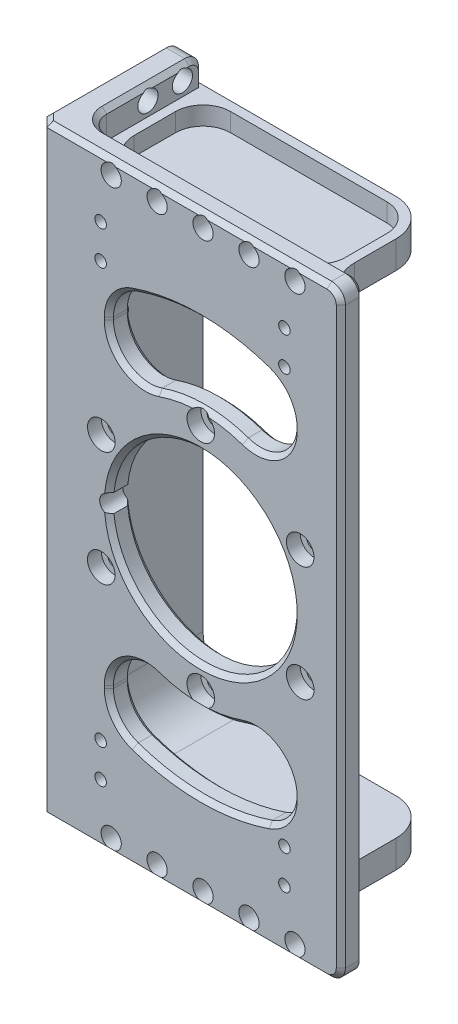
from build123d import *

# Parameters (mm, degrees)
SKETCH_1_W                  = 60
SKETCH_1_H                  = 131
EXTRUDE_1_DEPTH             = 5
SKETCH_2_W                  = 30
SKETCH_2_H                  = 131
EXTRUDE_2_DEPTH             = 6
SKETCH_3_R                  = 20
CUT_EXTRUDE_1_DEPTH         = 10
CHAMFER_1_SIZE              = 2
FILLET_1_R                  = 3
SKETCH_13_R                 = 1.6
CUT_EXTRUDE_2_DEPTH         = 6
SKETCH_14_R                 = 3
CUT_EXTRUDE_3_DEPTH         = 3
CHAMFER_4_SIZE              = 1
SKETCH_16_W                 = 50
SKETCH_16_H                 = 6
EXTRUDE_4_DEPTH             = 25
FILLET_3_R                  = 4
FILLET_4_R                  = 10
FILLET_5_R                  = 8
CUT_EXTRUDE_4_DEPTH         = 4
FILLET_6_R                  = 6
SKETCH_19_R                 = 2.2
CUT_EXTRUDE_5_DEPTH         = 18
SKETCH_20_R                 = 2.2
CUT_EXTRUDE_6_DEPTH         = 18
HOLE_WIZARD_M3_1_AT_2_COUNT = 2
HOLE_WIZARD_M3_1_AT_2_PITCH = 40
HOLE_WIZARD_M3_1_AT_3_COUNT = 2
HOLE_WIZARD_M3_1_AT_3_PITCH = 105.617529322
HOLE_WIZARD_M3_1_AT_4_COUNT = 2
HOLE_WIZARD_M3_1_AT_4_PITCH = 97.75
HOLE_WIZARD_M4_1_D          = 3.3
HOLE_WIZARD_M4_1_DEPTH      = 10.1
HOLE_WIZARD_M4_1_TIP        = 0.991420021
CUT_EXTRUDE_7_DEPTH         = 10
FILLET_7_R                  = 8
CHAMFER_5_SIZE              = 1
CHAMFER_6_SIZE              = 1
SKETCH_29_R                 = 2
CUT_EXTRUDE_8_DEPTH         = 10
SKETCH_30_R                 = 1.5
CUT_EXTRUDE_9_DEPTH         = 3
PATTERN_CIRCULAR_1_COUNT    = 6


# Some blends are built 0.0001 mm under size
with BuildPart() as part:
    # 草图1 → 凸台-拉伸1 (new body)
    with BuildSketch(Plane.XY):
        with Locations((-207.175860782, 60.5)):
            Rectangle(SKETCH_1_W, SKETCH_1_H)
    extrude(amount=EXTRUDE_1_DEPTH)

    # 草图2 → 凸台-拉伸2 (add)
    with BuildSketch(Plane.ZY.offset(237.175860782)):
        with Locations((-10, 60.5)):
            Rectangle(SKETCH_2_W, SKETCH_2_H)
    extrude(amount=EXTRUDE_2_DEPTH)

    # 草图3 → 切除-拉伸1 (cut)
    with BuildSketch(Plane.XY.offset(5)):
        with Locations((-207.675860782, 60.5)):
            Circle(SKETCH_3_R)
    extrude(amount=-CUT_EXTRUDE_1_DEPTH, mode=Mode.SUBTRACT)

    # 倒角1
    chamfer_1_edges = [part.edges().sort_by_distance(p)[0] for p in [
        (-243.175860782, 60.5, 5),
    ]]
    chamfer(chamfer_1_edges, length=CHAMFER_1_SIZE)

    # 圆角1
    fillet_1_edges = [part.edges().sort_by_distance(p)[0] for p in [
        (-240.175860782, 126, -25),
        (-240.175860782, -5, -25),
        (-177.175860782, 126, 2.5),
        (-177.175860782, -5, 2.5),
    ]]
    fillet(fillet_1_edges, radius=FILLET_1_R)

    # 草图13 → 切除-拉伸2 (cut)
    with BuildSketch(Plane.XY.offset(5)):
        with Locations((-207.675860782, 85.5)):
            Circle(SKETCH_13_R)
        with Locations((-229.326495877, 73)):
            Circle(SKETCH_13_R)
        with Locations((-186.025225688, 73)):
            Circle(SKETCH_13_R)
        with Locations((-186.025225688, 48)):
            Circle(SKETCH_13_R)
        with Locations((-207.675860782, 35.5)):
            Circle(SKETCH_13_R)
        with Locations((-229.326495877, 48)):
            Circle(SKETCH_13_R)
    extrude(amount=-CUT_EXTRUDE_2_DEPTH, mode=Mode.SUBTRACT)

    # 草图14 → 切除-拉伸3 (cut)
    with BuildSketch(Plane.XY.offset(5)):
        with Locations((-207.675860782, 85.5)):
            Circle(SKETCH_14_R)
        with Locations((-186.025225688, 73)):
            Circle(SKETCH_14_R)
        with Locations((-186.025225688, 48)):
            Circle(SKETCH_14_R)
        with Locations((-207.675860782, 35.5)):
            Circle(SKETCH_14_R)
        with Locations((-229.326495877, 48)):
            Circle(SKETCH_14_R)
        with Locations((-229.326495877, 73)):
            Circle(SKETCH_14_R)
    extrude(amount=-CUT_EXTRUDE_3_DEPTH, mode=Mode.SUBTRACT)

    # 倒角4
    chamfer_4_edges = [part.edges().sort_by_distance(p)[0] for p in [
        (-243.175860782, 126, -9.5),
        (-242.175860782, 126, 4),
        (-210.675860782, -5, 5),
        (-242.175860782, -5, 4),
        (-243.175860782, 60.5, -25),
        (-210.675860782, 126, 5),
        (-243.175860782, -5, -9.5),
        (-243.175860782, -4.121320344, -24.121320344),
        (-243.175860782, 125.121320344, -24.121320344),
        (-177.175860782, 60.5, 5),
        (-178.054540439, -4.121320344, 5),
        (-178.054540439, 125.121320344, 5),
    ]]
    chamfer(chamfer_4_edges, length=CHAMFER_4_SIZE)

    # 草图16 → 凸台-拉伸4 (add)
    with BuildSketch(Plane(origin=(0, 0, 0), x_dir=(-1, 0, 0), z_dir=(0, 0, -1))):
        with Locations((212.175860782, 117)):
            Rectangle(SKETCH_16_W, SKETCH_16_H)
    extrude_4 = extrude(amount=EXTRUDE_4_DEPTH)

    # 镜向1: 凸台-拉伸4 across plane
    add(extrude_4.mirror(Plane(origin=(0, 60.5, 0), x_dir=(0, 0, 1), z_dir=(0, -1, 0))))

    # 圆角3
    fillet_3_edges = [part.edges().sort_by_distance(p)[0] for p in [
        (-237.175860782, -2, 0),
        (-237.175860782, 123, 0),
    ]]
    fillet(fillet_3_edges, radius=FILLET_3_R)

    # 圆角4
    fillet_4_edges = [part.edges().sort_by_distance(p)[0] for p in [
        (-237.175860782, 114, -12.5),
        (-237.175860782, 7, -12.5),
    ]]
    fillet(fillet_4_edges, radius=FILLET_4_R)

    # 圆角5
    fillet_5_edges = [part.edges().sort_by_distance(p)[0] for p in [
        (-187.175860782, 117, -25),
        (-187.175860782, 117, 0),
        (-187.175860782, 4, 0),
        (-187.175860782, 4, -25),
    ]]
    fillet(fillet_5_edges, radius=FILLET_5_R)

    # 草图17 → 切除-拉伸4 (cut)
    with BuildSketch(Plane(origin=(0, 120, 0), x_dir=(1, 0, 0), z_dir=(0, 1, 0))):
        with BuildLine():
            Line((-235.175860782, 4), (-235.175860782, 2))
            Line((-235.175860782, 2), (-233.175860782, 2))
            Line((-233.175860782, 2), (-187.175860782, 2))
            ThreePointArc((-187.175860782, 2), (-188.662693763, 4.83772234), (-189.175860782, 8))
            Line((-189.175860782, 8), (-189.175860782, 17))
            ThreePointArc((-189.175860782, 17), (-190.933220095, 21.242640687), (-195.175860782, 23))
            Line((-195.175860782, 23), (-235.175860782, 23))
            Line((-235.175860782, 23), (-235.175860782, 4))
        make_face()
    cut_extrude_4 = extrude(amount=-CUT_EXTRUDE_4_DEPTH, mode=Mode.SUBTRACT)

    # 镜向2: 切除-拉伸4 across plane
    add(cut_extrude_4.mirror(Plane(origin=(0, 60.5, 0), x_dir=(0, 0, 1), z_dir=(0, -1, 0))), mode=Mode.SUBTRACT)

    # 圆角6
    fillet_6_edges = [part.edges().sort_by_distance(p)[0] for p in [
        (-187.175860782, 118, -2),
        (-235.175860782, 118, -23),
        (-235.175860782, 118, -2),
        (-235.175860782, 3, -23),
        (-187.175860782, 3, -2),
        (-235.175860782, 3, -2),
    ]]
    fillet(fillet_6_edges, radius=FILLET_6_R - 0.0001)  # a hair under: the kernel refuses the full size

    # 草图19 → 切除-拉伸5 (cut)
    with BuildSketch(Plane.XY.offset(5)):
        with Locations((-217.175860782, -2)):
            Circle(SKETCH_19_R)
        with Locations((-187.175860782, -2)):
            Circle(SKETCH_19_R)
        with Locations((-197.175860782, -2)):
            Circle(SKETCH_19_R)
        with Locations((-207.175860782, -2)):
            Circle(SKETCH_19_R)
        with Locations((-227.175860782, -2)):
            Circle(SKETCH_19_R)
    cut_extrude_5 = extrude(amount=-CUT_EXTRUDE_5_DEPTH, mode=Mode.SUBTRACT)

    # 镜向3: 切除-拉伸5 across plane
    add(cut_extrude_5.mirror(Plane(origin=(0, 60.5, 0), x_dir=(0, 0, 1), z_dir=(0, -1, 0))), mode=Mode.SUBTRACT)

    # 草图20 → 切除-拉伸6 (cut)
    with BuildSketch(Plane.ZY.offset(243.175860782)):
        with Locations((-20.5, -2)):
            Circle(SKETCH_20_R)
        with Locations((-13, -2)):
            Circle(SKETCH_20_R)
    cut_extrude_6 = extrude(amount=-CUT_EXTRUDE_6_DEPTH, mode=Mode.SUBTRACT)

    # 镜向4: 切除-拉伸6 across plane
    add(cut_extrude_6.mirror(Plane(origin=(0, 60.5, 0), x_dir=(0, 0, 1), z_dir=(0, -1, 0))), mode=Mode.SUBTRACT)

    # 草图23 → M3 螺纹孔1 (revolve, cut)
    with BuildSketch(Plane(origin=(-229.465860782, 113.065, 5), x_dir=(0, -1, 0), z_dir=(1, 0, 0))):
        Polygon((0, 0), (0, 8.251075774), (1.25, 7.5), (1.25, 0), align=None)
    hole_wizard_m3_1 = revolve(axis=Axis((-229.465860782, 113.065, 11.35), (0, 0, -1)), mode=Mode.SUBTRACT)

    # M3 螺纹孔1 at 2: M3 螺纹孔1 ×2
    with Locations(*[(i * HOLE_WIZARD_M3_1_AT_2_PITCH, 0, 0) for i in range(1, HOLE_WIZARD_M3_1_AT_2_COUNT)]):
        add(hole_wizard_m3_1, mode=Mode.SUBTRACT)

    # M3 螺纹孔1 at 3: M3 螺纹孔1 ×2
    with Locations(*[Vector(0.3787250114344214, -0.9255092466928666, 0) * (i * HOLE_WIZARD_M3_1_AT_3_PITCH) for i in range(1, HOLE_WIZARD_M3_1_AT_3_COUNT)]):
        add(hole_wizard_m3_1, mode=Mode.SUBTRACT)

    # M3 螺纹孔1 at 4: M3 螺纹孔1 ×2
    with Locations(*[(0, -i * HOLE_WIZARD_M3_1_AT_4_PITCH, 0) for i in range(1, HOLE_WIZARD_M3_1_AT_4_COUNT)]):
        add(hole_wizard_m3_1, mode=Mode.SUBTRACT)

    # 镜向5: M3 螺纹孔1 across plane
    add(hole_wizard_m3_1.mirror(Plane(origin=(0, 60.5, 0), x_dir=(0, 0, 1), z_dir=(0, -1, 0))), mode=Mode.SUBTRACT)

    # 镜向5 copy 1 sketch → 镜向5 copy 1 (revolve, cut)
    with BuildSketch(Plane(origin=(-189.465860782, 7.935, 5), x_dir=(0, 1, 0), z_dir=(1, 0, 0))):
        Polygon((0, 0), (0, -8.251075774), (1.25, -7.5), (1.25, 0), align=None)
    revolve(axis=Axis((-189.465860782, 7.935, 11.35), (0, 0, 1)), mode=Mode.SUBTRACT)

    # 镜向5 copy 2 sketch → 镜向5 copy 2 (revolve, cut)
    with BuildSketch(Plane(origin=(-189.465860782, 105.685, 5), x_dir=(0, 1, 0), z_dir=(1, 0, 0))):
        Polygon((0, 0), (0, -8.251075774), (1.25, -7.5), (1.25, 0), align=None)
    revolve(axis=Axis((-189.465860782, 105.685, 11.35), (0, 0, 1)), mode=Mode.SUBTRACT)

    # 镜向5 copy 3 sketch → 镜向5 copy 3 (revolve, cut)
    with BuildSketch(Plane(origin=(-229.465860782, 105.685, 5), x_dir=(0, 1, 0), z_dir=(1, 0, 0))):
        Polygon((0, 0), (0, -8.251075774), (1.25, -7.5), (1.25, 0), align=None)
    revolve(axis=Axis((-229.465860782, 105.685, 11.35), (0, 0, 1)), mode=Mode.SUBTRACT)

    # M4 螺纹孔1
    with Locations(Plane.ZY.offset(243.175860782)):
        with Locations((-7.12, 85.8), (-7.12, 35.2)):
            Hole(HOLE_WIZARD_M4_1_D / 2, depth=HOLE_WIZARD_M4_1_DEPTH)
            with Locations((0, 0, -(HOLE_WIZARD_M4_1_DEPTH + HOLE_WIZARD_M4_1_TIP / 2))):  # 118° drill point
                Cone(0, HOLE_WIZARD_M4_1_D / 2, HOLE_WIZARD_M4_1_TIP, mode=Mode.SUBTRACT)

    # 草图27 → 切除-拉伸7 (cut)
    with BuildSketch(Plane(origin=(0, 0, 0), x_dir=(-1, 0, 0), z_dir=(0, 0, -1))):
        with BuildLine():
            Line((187.675860782, 100.811288741), (187.675860782, 80.803940504))
            ThreePointArc((187.675860782, 80.803940504), (207.675860782, 89), (227.675860782, 80.803940504))
            Line((227.675860782, 80.803940504), (227.675860782, 100.811288741))
            ThreePointArc((227.675860782, 100.811288741), (207.675860782, 105.5), (187.675860782, 100.811288741))
        make_face()
        with BuildLine():
            Line((187.675860782, 40.196059496), (187.675860782, 20.188711259))
            ThreePointArc((187.675860782, 20.188711259), (207.675860782, 15.5), (227.675860782, 20.188711259))
            Line((227.675860782, 20.188711259), (227.675860782, 40.196059496))
            ThreePointArc((227.675860782, 40.196059496), (207.675860782, 32), (187.675860782, 40.196059496))
        make_face()
    extrude(amount=-CUT_EXTRUDE_7_DEPTH, mode=Mode.SUBTRACT)

    # 圆角7
    fillet_7_edges = [part.edges().sort_by_distance(p)[0] for p in [
        (-227.675860782, 80.803940504, 2.5),
        (-187.675860782, 80.803940504, 2.5),
        (-187.675860782, 100.811288741, 2.5),
        (-227.675860782, 100.811288741, 2.5),
        (-227.675860782, 20.188711259, 2.5),
        (-187.675860782, 20.188711259, 2.5),
        (-187.675860782, 40.196059496, 2.5),
        (-227.675860782, 40.196059496, 2.5),
    ]]
    fillet(fillet_7_edges, radius=FILLET_7_R)

    # 倒角5
    # the kernel refuses this chamfer: 1 mm, written as the material it takes off along each edge
    with BuildSketch(Plane(origin=(-207.675860782, 60.5, 0), x_dir=(1, 0, 0), z_dir=(0, -1, 0))) as chamfer_5_piece_1:
        Polygon((20 + CHAMFER_5_SIZE, 0), (20, CHAMFER_5_SIZE), (20, 0), align=None)
    revolve(axis=Axis((-207.675860782, 60.5, 0), (0, 0, 1)), mode=Mode.SUBTRACT)
    with BuildSketch(Plane(origin=(-207.675860782, 60.5, 5), x_dir=(1, 0, 0), z_dir=(0, -1, 0))) as chamfer_5_piece_2:
        Polygon((20, -CHAMFER_5_SIZE), (20 + CHAMFER_5_SIZE, 0), (20, 0), align=None)
    revolve(axis=Axis((-207.675860782, 60.5, 5), (0, 0, 1)), mode=Mode.SUBTRACT)
    with BuildSketch(Plane(origin=(-207.675860782, 60.5, 5), x_dir=(0.3243243243243247, -0.9459459459459458, 0), z_dir=(0.9459459459459458, 0.3243243243243247, 0))) as chamfer_5_piece_3:
        Polygon((45, CHAMFER_5_SIZE), (45 + CHAMFER_5_SIZE, 0), (45, 0), align=None)
    revolve(axis=Axis((-207.675860782, 60.5, 5), (0, 0, -1)), revolution_arc=37.849288832, mode=Mode.SUBTRACT)
    with BuildSketch(Plane(origin=(-207.675860782, 60.5, 0), x_dir=(0.3243243243243247, -0.9459459459459458, 0), z_dir=(0.9459459459459458, 0.3243243243243247, 0))) as chamfer_5_piece_4:
        Polygon((45 + CHAMFER_5_SIZE, 0), (45, -CHAMFER_5_SIZE), (45, 0), align=None)
    revolve(axis=Axis((-207.675860782, 60.5, 0), (0, 0, -1)), revolution_arc=37.849288832, mode=Mode.SUBTRACT)
    with BuildSketch(Plane(origin=(-187.675860782, 26.028997694, 5), x_dir=(-0.02749587661058217, 0, -0.9996219169112968), z_dir=(0, -1, 0)), Plane(origin=(-187.675860782, 26.028997694, 0), x_dir=(0.9996219169112968, 0, -0.027495876610586483), z_dir=(0, -1, 0)), Plane(origin=(-227.675860782, 25.5, 5), x_dir=(0.02749587661058217, 0, -0.9996219169112968), z_dir=(0, 1, 0)), Plane(origin=(-227.675860782, 25.5, 0), x_dir=(-0.9996219169112968, 0, -0.027495876610586483), z_dir=(0, 1, 0)), Plane(origin=(-187.675860782, 95.5, 5), x_dir=(-0.02749587661058217, 0, -0.9996219169112968), z_dir=(0, -1, 0)), Plane(origin=(-187.675860782, 95.5, 0), x_dir=(0.9996219169112968, 0, -0.027495876610586483), z_dir=(0, -1, 0)), Plane(origin=(-227.675860782, 94.971002306, 5), x_dir=(0.02749587661058217, 0, -0.9996219169112968), z_dir=(0, 1, 0)), Plane(origin=(-227.675860782, 94.971002306, 0), x_dir=(-0.9996219169112968, 0, -0.027495876610586483), z_dir=(0, 1, 0))) as chamfer_5_piece_5:
        Polygon((CHAMFER_5_SIZE * 0.999621916911, CHAMFER_5_SIZE * 0.0274958766106), (-CHAMFER_5_SIZE * 0.0274958766106, CHAMFER_5_SIZE * 0.999621916911), (0, 0), align=None)
    extrude(amount=0.528997694, mode=Mode.SUBTRACT)
    with BuildSketch(Plane(origin=(-207.675860782, 60.5, 5), x_dir=(0.3287671232876714, -0.9444110220900375, 0), z_dir=(0.9444110220900375, 0.3287671232876714, 0))) as chamfer_5_piece_6:
        Polygon((28.5, CHAMFER_5_SIZE), (28.5 - CHAMFER_5_SIZE, 0), (28.5, 0), align=None)
    revolve(axis=Axis((-207.675860782, 60.5, 5), (0, 0, -1)), revolution_arc=38.387923948, mode=Mode.SUBTRACT)
    with BuildSketch(Plane(origin=(-207.675860782, 60.5, 0), x_dir=(-0.3287671232876714, -0.9444110220900375, 0), z_dir=(-0.9444110220900375, 0.3287671232876714, 0))) as chamfer_5_piece_7:
        Polygon((28.5 - CHAMFER_5_SIZE, 0), (28.5, CHAMFER_5_SIZE), (28.5, 0), align=None)
    revolve(axis=Axis((-207.675860782, 60.5, 0), (0, 0, 1)), revolution_arc=38.387923948, mode=Mode.SUBTRACT)
    with BuildSketch(Plane(origin=(-207.675860782, 60.5, 5), x_dir=(-0.3287671232876707, 0.9444110220900377, 0), z_dir=(-0.9444110220900377, -0.3287671232876707, 0))) as chamfer_5_piece_8:
        Polygon((28.5, CHAMFER_5_SIZE), (28.5 - CHAMFER_5_SIZE, 0), (28.5, 0), align=None)
    revolve(axis=Axis((-207.675860782, 60.5, 5), (0, 0, -1)), revolution_arc=38.387923948, mode=Mode.SUBTRACT)
    with BuildSketch(Plane(origin=(-207.675860782, 60.5, 0), x_dir=(0.3287671232876697, 0.944411022090038, 0), z_dir=(0.944411022090038, -0.3287671232876697, 0))) as chamfer_5_piece_9:
        Polygon((28.5 - CHAMFER_5_SIZE, 0), (28.5, CHAMFER_5_SIZE), (28.5, 0), align=None)
    revolve(axis=Axis((-207.675860782, 60.5, 0), (0, 0, 1)), revolution_arc=38.387923948, mode=Mode.SUBTRACT)
    with BuildSketch(Plane(origin=(-207.675860782, 60.5, 5), x_dir=(-0.32432432432432445, 0.9459459459459459, 0), z_dir=(-0.9459459459459459, -0.32432432432432445, 0))) as chamfer_5_piece_10:
        Polygon((45, CHAMFER_5_SIZE), (45 + CHAMFER_5_SIZE, 0), (45, 0), align=None)
    revolve(axis=Axis((-207.675860782, 60.5, 5), (0, 0, -1)), revolution_arc=37.849288832, mode=Mode.SUBTRACT)
    with BuildSketch(Plane(origin=(-207.675860782, 60.5, 0), x_dir=(-0.32432432432432434, 0.9459459459459459, 0), z_dir=(-0.9459459459459459, -0.32432432432432434, 0))) as chamfer_5_piece_11:
        Polygon((45 + CHAMFER_5_SIZE, 0), (45, -CHAMFER_5_SIZE), (45, 0), align=None)
    revolve(axis=Axis((-207.675860782, 60.5, 0), (0, 0, -1)), revolution_arc=37.849288832, mode=Mode.SUBTRACT)
    with BuildSketch(Plane(origin=(-195.675860782, 25.5, 0), x_dir=(1, 0, 0), z_dir=(0, 1, 0))) as chamfer_5_piece_12:
        Polygon((8 + CHAMFER_5_SIZE, 0), (8, -CHAMFER_5_SIZE), (8, 0), align=None)
    revolve(axis=Axis((-195.675860782, 25.5, 0), (0, 0, -1)), revolution_arc=71.075355584, mode=Mode.SUBTRACT)
    with BuildSketch(Plane(origin=(-195.675860782, 25.5, 5), x_dir=(1, 0, 0), z_dir=(0, 1, 0))) as chamfer_5_piece_13:
        Polygon((8, CHAMFER_5_SIZE), (8 + CHAMFER_5_SIZE, 0), (8, 0), align=None)
    revolve(axis=Axis((-195.675860782, 25.5, 5), (0, 0, -1)), revolution_arc=71.075355584, mode=Mode.SUBTRACT)
    with BuildSketch(Plane(origin=(-219.675860782, 26.028997694, 0), x_dir=(-1, 0, 0), z_dir=(0, -1, 0))) as chamfer_5_piece_14:
        Polygon((8 + CHAMFER_5_SIZE, 0), (8, -CHAMFER_5_SIZE), (8, 0), align=None)
    revolve(axis=Axis((-219.675860782, 26.028997694, 0), (0, 0, -1)), revolution_arc=109.193961974, mode=Mode.SUBTRACT)
    with BuildSketch(Plane(origin=(-219.675860782, 26.028997694, 5), x_dir=(-1, 0, 0), z_dir=(0, -1, 0))) as chamfer_5_piece_15:
        Polygon((8, CHAMFER_5_SIZE), (8 + CHAMFER_5_SIZE, 0), (8, 0), align=None)
    revolve(axis=Axis((-219.675860782, 26.028997694, 5), (0, 0, -1)), revolution_arc=109.193961974, mode=Mode.SUBTRACT)
    with BuildSketch(Plane(origin=(-219.675860782, 25.5, 0), x_dir=(-0.3243243243243228, -0.9459459459459465, 0), z_dir=(0.9459459459459465, -0.3243243243243228, 0))) as chamfer_5_piece_16:
        Polygon((8 + CHAMFER_5_SIZE, 0), (8, -CHAMFER_5_SIZE), (8, 0), align=None)
    revolve(axis=Axis((-219.675860782, 25.5, 0), (0, 0, -1)), revolution_arc=71.075355584, mode=Mode.SUBTRACT)
    with BuildSketch(Plane(origin=(-219.675860782, 25.5, 5), x_dir=(-0.3243243243243228, -0.9459459459459465, 0), z_dir=(0.9459459459459465, -0.3243243243243228, 0))) as chamfer_5_piece_17:
        Polygon((8, CHAMFER_5_SIZE), (8 + CHAMFER_5_SIZE, 0), (8, 0), align=None)
    revolve(axis=Axis((-219.675860782, 25.5, 5), (0, 0, -1)), revolution_arc=71.075355584, mode=Mode.SUBTRACT)
    with BuildSketch(Plane(origin=(-195.675860782, 26.028997694, 0), x_dir=(1, 0, 0), z_dir=(0, -1, 0))) as chamfer_5_piece_18:
        Polygon((8 + CHAMFER_5_SIZE, 0), (8, CHAMFER_5_SIZE), (8, 0), align=None)
    revolve(axis=Axis((-195.675860782, 26.028997694, 0), (0, 0, 1)), revolution_arc=109.193961974, mode=Mode.SUBTRACT)
    with BuildSketch(Plane(origin=(-195.675860782, 26.028997694, 5), x_dir=(1, 0, 0), z_dir=(0, -1, 0))) as chamfer_5_piece_19:
        Polygon((8, -CHAMFER_5_SIZE), (8 + CHAMFER_5_SIZE, 0), (8, 0), align=None)
    revolve(axis=Axis((-195.675860782, 26.028997694, 5), (0, 0, 1)), revolution_arc=109.193961974, mode=Mode.SUBTRACT)
    with BuildSketch(Plane(origin=(-195.675860782, 94.971002306, 0), x_dir=(1, 0, 0), z_dir=(0, 1, 0))) as chamfer_5_piece_20:
        Polygon((8 + CHAMFER_5_SIZE, 0), (8, -CHAMFER_5_SIZE), (8, 0), align=None)
    revolve(axis=Axis((-195.675860782, 94.971002306, 0), (0, 0, -1)), revolution_arc=109.193961974, mode=Mode.SUBTRACT)
    with BuildSketch(Plane(origin=(-195.675860782, 94.971002306, 5), x_dir=(1, 0, 0), z_dir=(0, 1, 0))) as chamfer_5_piece_21:
        Polygon((8, CHAMFER_5_SIZE), (8 + CHAMFER_5_SIZE, 0), (8, 0), align=None)
    revolve(axis=Axis((-195.675860782, 94.971002306, 5), (0, 0, -1)), revolution_arc=109.193961974, mode=Mode.SUBTRACT)
    with BuildSketch(Plane(origin=(-219.675860782, 95.5, 0), x_dir=(-1, 0, 0), z_dir=(0, -1, 0))) as chamfer_5_piece_22:
        Polygon((8 + CHAMFER_5_SIZE, 0), (8, -CHAMFER_5_SIZE), (8, 0), align=None)
    revolve(axis=Axis((-219.675860782, 95.5, 0), (0, 0, -1)), revolution_arc=71.075355584, mode=Mode.SUBTRACT)
    with BuildSketch(Plane(origin=(-219.675860782, 95.5, 5), x_dir=(-1, 0, 0), z_dir=(0, -1, 0))) as chamfer_5_piece_23:
        Polygon((8, CHAMFER_5_SIZE), (8 + CHAMFER_5_SIZE, 0), (8, 0), align=None)
    revolve(axis=Axis((-219.675860782, 95.5, 5), (0, 0, -1)), revolution_arc=71.075355584, mode=Mode.SUBTRACT)
    with BuildSketch(Plane(origin=(-219.675860782, 94.971002306, 0), x_dir=(0.32876712328767255, -0.944411022090037, 0), z_dir=(0.944411022090037, 0.32876712328767255, 0))) as chamfer_5_piece_24:
        Polygon((8 + CHAMFER_5_SIZE, 0), (8, -CHAMFER_5_SIZE), (8, 0), align=None)
    revolve(axis=Axis((-219.675860782, 94.971002306, 0), (0, 0, -1)), revolution_arc=109.193961974, mode=Mode.SUBTRACT)
    with BuildSketch(Plane(origin=(-219.675860782, 94.971002306, 5), x_dir=(0.32876712328767255, -0.944411022090037, 0), z_dir=(0.944411022090037, 0.32876712328767255, 0))) as chamfer_5_piece_25:
        Polygon((8, CHAMFER_5_SIZE), (8 + CHAMFER_5_SIZE, 0), (8, 0), align=None)
    revolve(axis=Axis((-219.675860782, 94.971002306, 5), (0, 0, -1)), revolution_arc=109.193961974, mode=Mode.SUBTRACT)
    with BuildSketch(Plane(origin=(-195.675860782, 95.5, 0), x_dir=(1, 0, 0), z_dir=(0, -1, 0))) as chamfer_5_piece_26:
        Polygon((8 + CHAMFER_5_SIZE, 0), (8, CHAMFER_5_SIZE), (8, 0), align=None)
    revolve(axis=Axis((-195.675860782, 95.5, 0), (0, 0, 1)), revolution_arc=71.075355584, mode=Mode.SUBTRACT)
    with BuildSketch(Plane(origin=(-195.675860782, 95.5, 5), x_dir=(1, 0, 0), z_dir=(0, -1, 0))) as chamfer_5_piece_27:
        Polygon((8, -CHAMFER_5_SIZE), (8 + CHAMFER_5_SIZE, 0), (8, 0), align=None)
    revolve(axis=Axis((-195.675860782, 95.5, 5), (0, 0, 1)), revolution_arc=71.075355584, mode=Mode.SUBTRACT)

    # 倒角6
    # the kernel refuses this chamfer: 1 mm, written as the material it takes off along each edge
    with BuildSketch(Plane(origin=(-237.175860782, -2, -25), x_dir=(-0.9996219169112968, 0, -0.02749587661058574), z_dir=(0, 1, 0)), Plane(origin=(-237.175860782, 120, -25), x_dir=(-0.9996219169112968, 0, -0.02749587661058574), z_dir=(0, 1, 0))) as chamfer_6_piece_1:
        Polygon((CHAMFER_6_SIZE * 0.999621916911, CHAMFER_6_SIZE * 0.0274958766106), (-CHAMFER_6_SIZE * 0.0274958766106, CHAMFER_6_SIZE * 0.999621916911), (0, 0), align=None)
    extrude(amount=3, mode=Mode.SUBTRACT)
    with BuildSketch(Plane(origin=(-180.175860782, -5, 0), x_dir=(0, 0.9996219169112968, -0.027495876610586365), z_dir=(-1, 0, 0)), Plane(origin=(-233.175860782, 126, 0), x_dir=(0, -0.9996219169112968, -0.027495876610586483), z_dir=(1, 0, 0))) as chamfer_6_piece_2:
        Polygon((CHAMFER_6_SIZE * 0.999621916911, -CHAMFER_6_SIZE * 0.0274958766106), (-CHAMFER_6_SIZE * 0.0274958766106, -CHAMFER_6_SIZE * 0.999621916911), (0, 0), align=None)
    extrude(amount=53, mode=Mode.SUBTRACT)
    with BuildSketch(Plane(origin=(-237.175860782, 126, -22), x_dir=(-0.999621916911297, 0.027495876610582292, 0), z_dir=(0, 0, 1)), Plane(origin=(-237.175860782, -5, -4), x_dir=(-0.9996219169112968, -0.02749587661058574, 0), z_dir=(0, 0, -1))) as chamfer_6_piece_3:
        Polygon((CHAMFER_6_SIZE * 0.999621916911, CHAMFER_6_SIZE * 0.0274958766106), (-CHAMFER_6_SIZE * 0.0274958766106, CHAMFER_6_SIZE * 0.999621916911), (0, 0), align=None)
    extrude(amount=18, mode=Mode.SUBTRACT)
    with BuildSketch(Plane(origin=(-233.175860782, -5, -4), x_dir=(0, 0, 1), z_dir=(1, 0, 0))) as chamfer_6_piece_4:
        Polygon((4 + CHAMFER_6_SIZE, 0), (4, -CHAMFER_6_SIZE), (4, 0), align=None)
    revolve(axis=Axis((-233.175860782, -5, -4), (0, -1, 0)), revolution_arc=90, mode=Mode.SUBTRACT)
    with BuildSketch(Plane(origin=(-233.175860782, 126, -4), x_dir=(-1, 0, 0), z_dir=(0, 0, -1))) as chamfer_6_piece_5:
        Polygon((4, -CHAMFER_6_SIZE), (4 + CHAMFER_6_SIZE, 0), (4, 0), align=None)
    revolve(axis=Axis((-233.175860782, 126, -4), (0, 1, 0)), revolution_arc=90, mode=Mode.SUBTRACT)
    with BuildSketch(Plane(origin=(-237.175860782, -2, -22), x_dir=(0, 0, -1), z_dir=(0, 1, 0))) as chamfer_6_piece_6:
        Polygon((3 - CHAMFER_6_SIZE, 0), (3, CHAMFER_6_SIZE), (3, 0), align=None)
    revolve(axis=Axis((-237.175860782, -2, -22), (-1, 0, 0)), revolution_arc=90, mode=Mode.SUBTRACT)
    with BuildSketch(Plane(origin=(-237.175860782, 123, -22), x_dir=(0, 1, 0), z_dir=(0, 0, 1))) as chamfer_6_piece_7:
        Polygon((3 - CHAMFER_6_SIZE, 0), (3, CHAMFER_6_SIZE), (3, 0), align=None)
    revolve(axis=Axis((-237.175860782, 123, -22), (-1, 0, 0)), revolution_arc=90, mode=Mode.SUBTRACT)
    with BuildSketch(Plane(origin=(-177.175860782, 123, 0), x_dir=(-0.9996219169112968, 0, -0.027495876610586483), z_dir=(0, -1, 0))) as chamfer_6_piece_8:
        Polygon((CHAMFER_6_SIZE * 0.999621916911, -CHAMFER_6_SIZE * 0.0274958766106), (-CHAMFER_6_SIZE * 0.0274958766106, -CHAMFER_6_SIZE * 0.999621916911), (0, 0), align=None)
    extrude(amount=125, mode=Mode.SUBTRACT)
    with BuildSketch(Plane(origin=(-180.175860782, -2, 0), x_dir=(1, 0, 0), z_dir=(0, 1, 0))) as chamfer_6_piece_9:
        Polygon((3 - CHAMFER_6_SIZE, 0), (3, -CHAMFER_6_SIZE), (3, 0), align=None)
    revolve(axis=Axis((-180.175860782, -2, 0), (0, 0, -1)), revolution_arc=90, mode=Mode.SUBTRACT)
    with BuildSketch(Plane(origin=(-180.175860782, 123, 0), x_dir=(0, 1, 0), z_dir=(-1, 0, 0))) as chamfer_6_piece_10:
        Polygon((3 - CHAMFER_6_SIZE, 0), (3, -CHAMFER_6_SIZE), (3, 0), align=None)
    revolve(axis=Axis((-180.175860782, 123, 0), (0, 0, -1)), revolution_arc=90, mode=Mode.SUBTRACT)

    # 草图29 → 切除-拉伸8 (cut)
    with BuildSketch(Plane.XY.offset(5)):
        with Locations((-227.675860782, 60.500000003)):
            Circle(SKETCH_29_R)
    extrude(amount=-CUT_EXTRUDE_8_DEPTH, mode=Mode.SUBTRACT)

    # 草图30 → 切除-拉伸9 (cut)
    with BuildSketch(Plane(origin=(0, 0, 0), x_dir=(-1, 0, 0), z_dir=(0, 0, -1))):
        with Locations((214.14633691, 36.351854343)):
            Circle(SKETCH_30_R)
    cut_extrude_9 = extrude(amount=-CUT_EXTRUDE_9_DEPTH, mode=Mode.SUBTRACT)

    # 阵列(圆周)1: 切除-拉伸9 ×6 about axis
    pattern_circular_1_axis = Axis((-207.675860782, 60.5, 0), (0, 0, 1))
    for i in range(1, PATTERN_CIRCULAR_1_COUNT):
        add(cut_extrude_9.rotate(pattern_circular_1_axis, i * 360 / PATTERN_CIRCULAR_1_COUNT), mode=Mode.SUBTRACT)


solid = part.part
